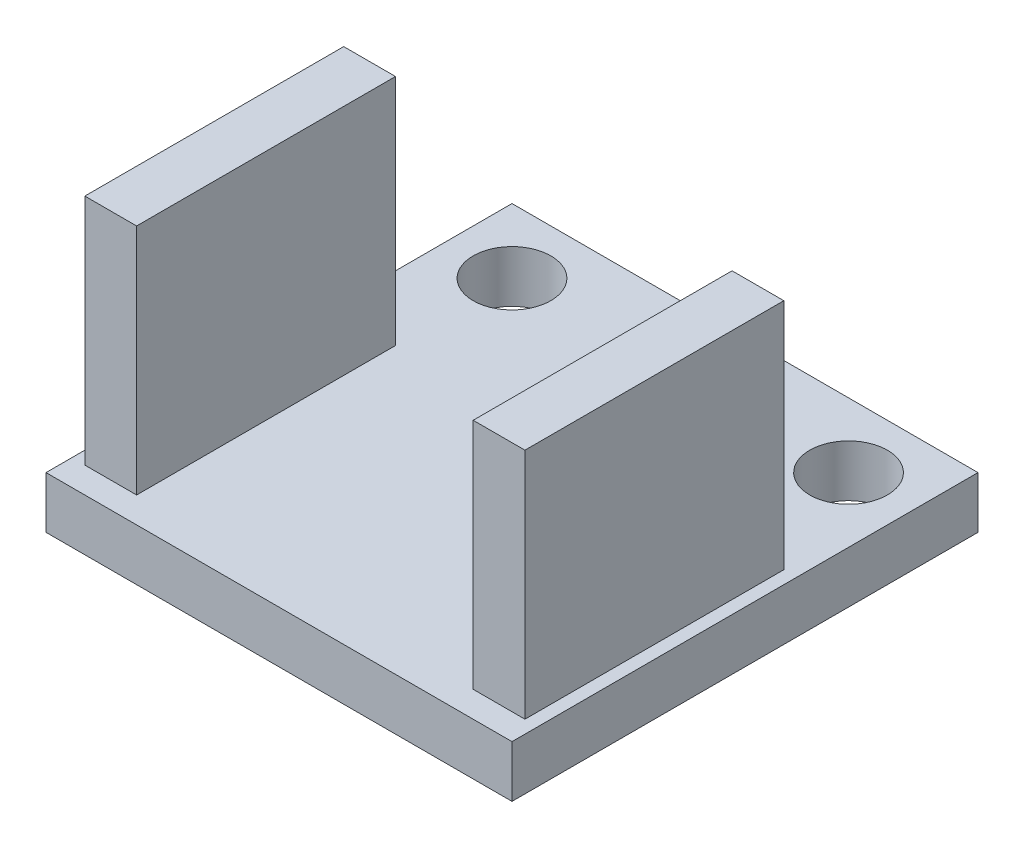
from build123d import *

# Parameters (mm, degrees)
SKETCH1_W           = 18
SKETCH1_H           = 18
BOSS_EXTRUDE1_DEPTH = 2
SKETCH2_R           = 1.5
CUT_EXTRUDE1_DEPTH  = 2
SKETCH3_W           = 2
SKETCH3_H           = 10
BOSS_EXTRUDE2_DEPTH = 9


with BuildPart() as part:
    # Sketch1 → Boss-Extrude1 (new body)
    with BuildSketch(Plane(origin=(0, 0, 0), x_dir=(1, 0, 0), z_dir=(0, 1, 0))):
        with Locations((9, -9)):
            Rectangle(SKETCH1_W, SKETCH1_H)
    extrude(amount=BOSS_EXTRUDE1_DEPTH)

    # Sketch2 → Cut-Extrude1 (cut)
    with BuildSketch(Plane(origin=(0, 2, 0), x_dir=(1, 0, 0), z_dir=(0, 1, 0))):
        with Locations((2.5, -2.5)):
            Circle(SKETCH2_R)
        with Locations((15.5, -2.5)):
            Circle(SKETCH2_R)
    extrude(amount=-CUT_EXTRUDE1_DEPTH, mode=Mode.SUBTRACT)

    # Sketch3 → Boss-Extrude2 (add)
    with BuildSketch(Plane(origin=(0, 2, 0), x_dir=(1, 0, 0), z_dir=(0, 1, 0))):
        with Locations((1.5, -12)):
            Rectangle(SKETCH3_W, SKETCH3_H)
        with Locations((16.5, -12)):
            Rectangle(SKETCH3_W, SKETCH3_H)
    extrude(amount=BOSS_EXTRUDE2_DEPTH)


solid = part.part
